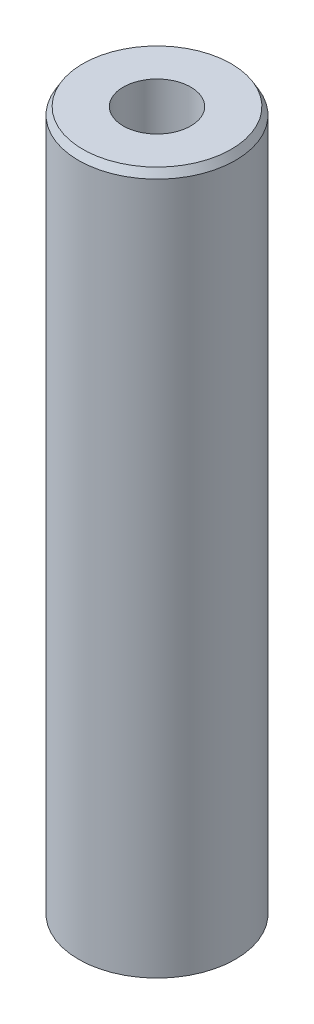
from build123d import *
from OCP.BRepFilletAPI import BRepFilletAPI_MakeChamfer

# Parameters (mm, degrees)
SKETCH1_R           = 10
BOSS_EXTRUDE1_DEPTH = 89.643929894
SKETCH2_R           = 4.299680145
CUT_EXTRUDE1_DEPTH  = 91.752598678
CHAMFER1_SIZE       = 0.946929219
CHAMFER1_SIZE2      = 0.546709839


with BuildPart() as part:
    # Sketch1 → Boss-Extrude1 (new body)
    with BuildSketch(Plane(origin=(0, 0, 0), x_dir=(1, 0, 0), z_dir=(0, 1, 0))):
        Circle(SKETCH1_R)
    extrude(amount=BOSS_EXTRUDE1_DEPTH)

    # Sketch2 → Cut-Extrude1 (cut, through all)
    with BuildSketch(Plane(origin=(0, 0, 0), x_dir=(1, 0, 0), z_dir=(0, 1, 0))):
        Circle(SKETCH2_R)
    extrude(amount=CUT_EXTRUDE1_DEPTH, mode=Mode.SUBTRACT)

    # Chamfer1: one chamfer whose edges measure the first distance from different faces: ONE call of the kernel's chamfer builder (chamfer() names one face for all edges)
    chamfer1_edges_1 = [part.edges().sort_by_distance(p)[0] for p in [
        (-10, 89.643929894, 0),
    ]]
    chamfer1_side_1 = [part.faces().sort_by_distance(p)[0] for p in [
        (-10, 44.821964947, 0),
    ]]
    chamfer1_edges_2 = [part.edges().sort_by_distance(p)[0] for p in [
        (-10, 0, 0),
    ]]
    chamfer1_side_2 = [part.faces().sort_by_distance(p)[0] for p in [
        (-9.717157288, 0, 0),
    ]]
    chamfer1 = BRepFilletAPI_MakeChamfer(part.part.solid().wrapped)
    for e in chamfer1_edges_1:
        chamfer1.Add(CHAMFER1_SIZE, CHAMFER1_SIZE2, e.wrapped, chamfer1_side_1[0].wrapped)  # the first distance lies on this face
    for e in chamfer1_edges_2:
        chamfer1.Add(CHAMFER1_SIZE, CHAMFER1_SIZE2, e.wrapped, chamfer1_side_2[0].wrapped)  # the first distance lies on this face
    add(Compound.cast(chamfer1.Shape()), mode=Mode.REPLACE)


solid = part.part
